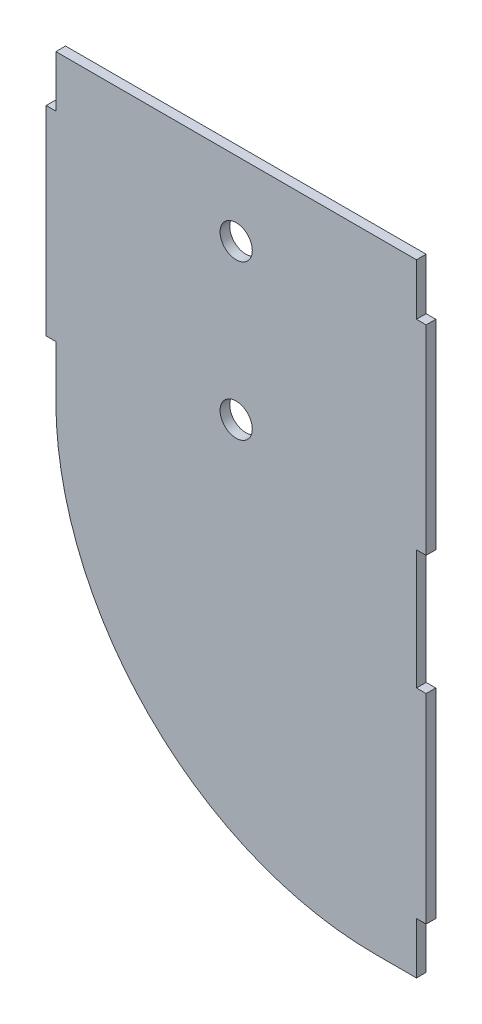
from build123d import *

# Parameters (mm, degrees)
EXTRUDE1_DEPTH     = 4.7625
CUT_EXTRUDE1_REACH = 297.29
SKETCH2_R          = 7.9375


with BuildPart() as part:
    # Sketch1 → Extrude1 (new body)
    with BuildSketch(Plane.XY):
        with BuildLine():
            Line((0, 74.6125), (-177.8, 74.6125))
            Line((-177.8, 74.6125), (-177.8, 49.2125))
            Line((-177.8, 49.2125), (-182.5625, 49.2125))
            Line((-182.5625, 49.2125), (-182.5625, -49.2125))
            Line((-182.5625, -49.2125), (-177.8, -49.2125))
            Line((-177.8, -49.2125), (-177.8, -74.6125))
            ThreePointArc((-177.8, -74.6125), (-131.689210331, -185.933793792), (-20.367916539, -232.044583461))
            Line((-20.367916539, -232.044583461), (0, -232.044583461))
            Line((0, -232.044583461), (0, -206.644583461))
            Line((0, -206.644583461), (4.7625, -206.644583461))
            Line((4.7625, -206.644583461), (4.7625, -108.219583461))
            Line((4.7625, -108.219583461), (0, -108.219583461))
            Line((0, -108.219583461), (0, -49.2125))
            Line((0, -49.2125), (4.7625, -49.2125))
            Line((4.7625, -49.2125), (4.7625, 49.2125))
            Line((4.7625, 49.2125), (0, 49.2125))
            Line((0, 49.2125), (0, 74.6125))
        make_face()
    extrude(amount=-EXTRUDE1_DEPTH)

    # Sketch2 → Cut-Extrude1 (cut, up to next)
    with BuildSketch(Plane.XY, mode=Mode.PRIVATE) as cut_extrude1_sk1:
        with Locations((-88.9, 38.1)):
            Circle(SKETCH2_R)
    cut_extrude1_tool1 = extrude(cut_extrude1_sk1.sketch, amount=-CUT_EXTRUDE1_REACH, mode=Mode.PRIVATE) & part.part
    # Sketch2 → Cut-Extrude1 (cut, up to next)
    with BuildSketch(Plane.XY, mode=Mode.PRIVATE) as cut_extrude1_sk2:
        with Locations((-88.9, -38.1)):
            Circle(SKETCH2_R)
    cut_extrude1_tool2 = extrude(cut_extrude1_sk2.sketch, amount=-CUT_EXTRUDE1_REACH, mode=Mode.PRIVATE) & part.part
    add(cut_extrude1_tool1.solids().sort_by_distance((-88.9, 38.1, 0))[0], mode=Mode.SUBTRACT)
    add(cut_extrude1_tool2.solids().sort_by_distance((-88.9, -38.1, 0))[0], mode=Mode.SUBTRACT)


solid = part.part
